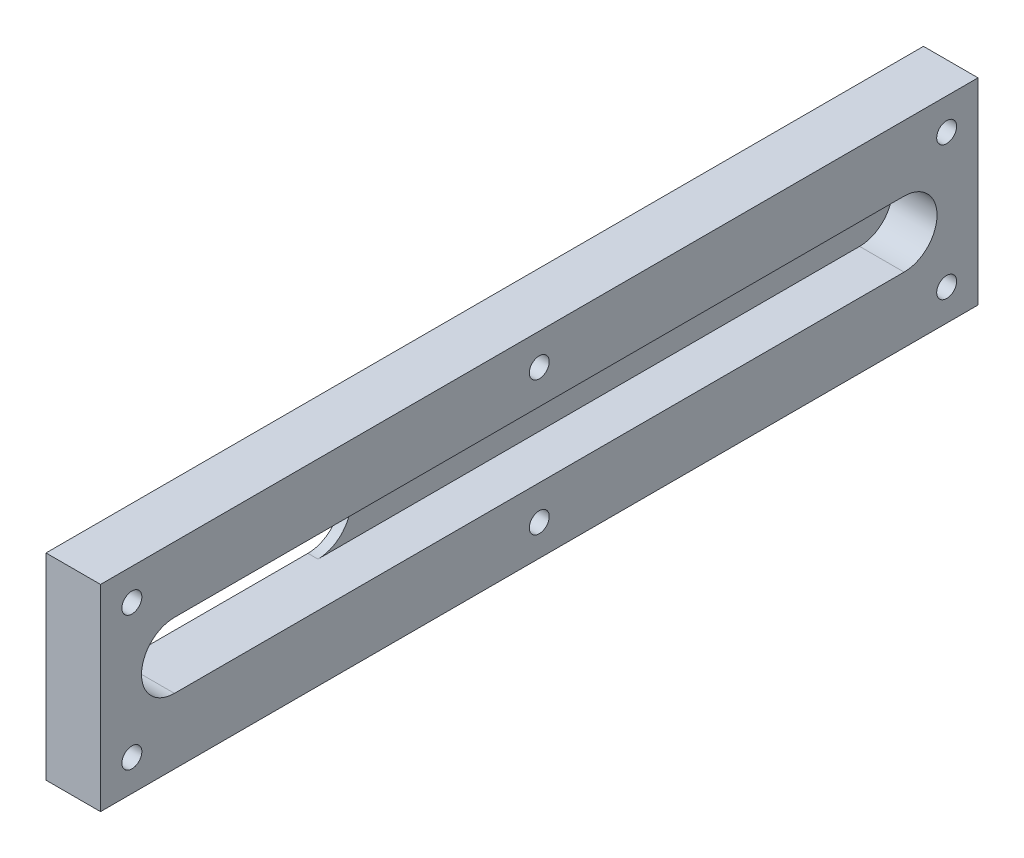
from build123d import *

# Parameters (mm, degrees)
SKETCH1_W              = 177.8
SKETCH1_H              = 39.878
BOSS_EXTRUDE1_DEPTH    = 11.049
F_10_32_TAPPED_HOLE1_D = 4.0386
BOSS_EXTRUDE2_DEPTH    = 2.032


with BuildPart() as part:
    # Sketch1 → Boss-Extrude1 (new body)
    with BuildSketch(Plane(origin=(0, 0, 0), x_dir=(0, 0, -1), z_dir=(1, 0, 0))):
        Rectangle(SKETCH1_W, SKETCH1_H)
        with BuildLine():
            Line((-73.9252522, 6.6675), (73.9252522, 6.6675))
            ThreePointArc((73.9252522, 6.6675), (80.5927522, 0), (73.9252522, -6.6675))
            Line((73.9252522, -6.6675), (-73.9252522, -6.6675))
            ThreePointArc((-73.9252522, -6.6675), (-80.5927522, 0), (-73.9252522, 6.6675))
        make_face(mode=Mode.SUBTRACT)
    extrude(amount=BOSS_EXTRUDE1_DEPTH)

    # #10-32 Tapped Hole1 (through all)
    with Locations(Plane(origin=(11.049, 0, 0), x_dir=(0, 0, -1), z_dir=(1, 0, 0))):
        with Locations((-82.55, 13.589), (-82.55, -13.589), (0, -13.589), (82.55, -13.589), (82.55, 13.589), (0, 13.589)):
            Hole(F_10_32_TAPPED_HOLE1_D / 2)

    # Sketch5 → Boss-Extrude2 (add)
    with BuildSketch(Plane.ZY):
        with BuildLine():
            Line((-73.9252522, -6.6675), (35.8252522, -6.6675))
            ThreePointArc((35.8252522, -6.6675), (29.1577522, 0), (35.8252522, 6.6675))
            Line((35.8252522, 6.6675), (-73.9252522, 6.6675))
            ThreePointArc((-73.9252522, 6.6675), (-80.5927522, 0), (-73.9252522, -6.6675))
        make_face()
    extrude(amount=-BOSS_EXTRUDE2_DEPTH)


solid = part.part
